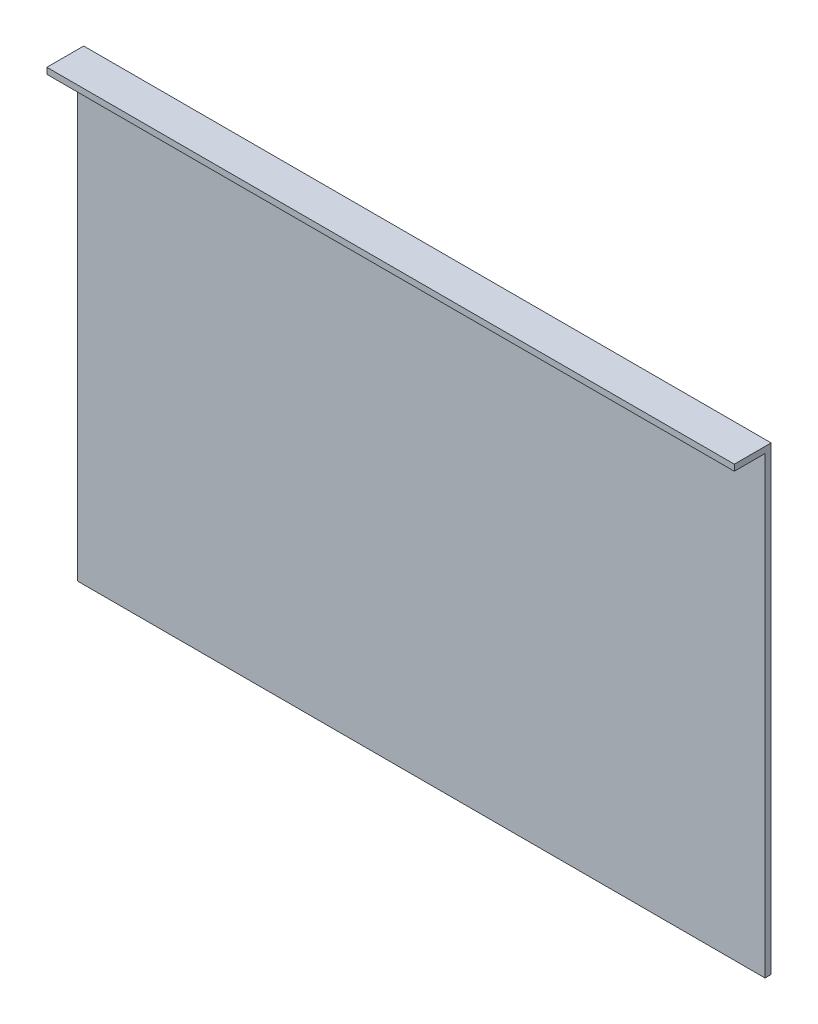
from build123d import *

# Parameters (mm, degrees)
SKETCH1_W           = 448
SKETCH1_H           = 300
BASE_FLANGE1_DEPTH  = 4
SKETCH13_W          = 448
SKETCH13_H          = 4
BOSS_EXTRUDE1_DEPTH = 20


# Sheet-metal steps are written as plain solids
with BuildPart() as part:
    # Sketch1 → Base-Flange1 (new body)
    with BuildSketch(Plane.XY):
        with Locations((224, 150)):
            Rectangle(SKETCH1_W, SKETCH1_H)
    extrude(amount=-BASE_FLANGE1_DEPTH)

    # Sketch13 → Boss-Extrude1 (add)
    with BuildSketch(Plane.XY):
        with Locations((224, 298)):
            Rectangle(SKETCH13_W, SKETCH13_H)
    extrude(amount=BOSS_EXTRUDE1_DEPTH)


solid = part.part
